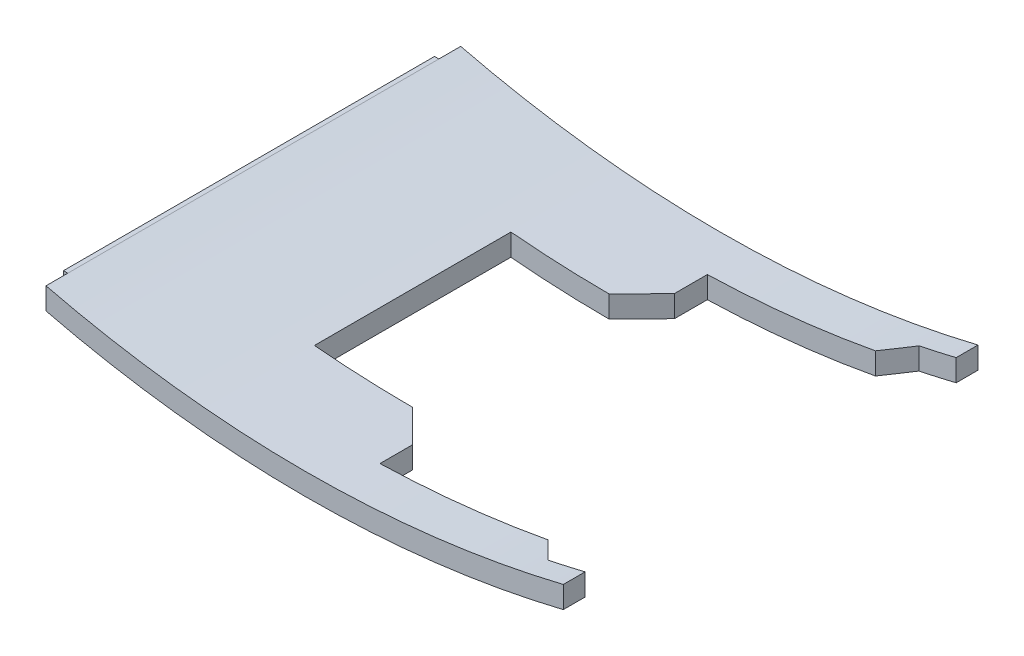
from build123d import *

# Parameters (mm, degrees)
BOSS_EXTRUDE1_DEPTH = 48.26
SKETCH4_W           = 41.656
SKETCH4_H           = 22.86
CUT_EXTRUDE1_DEPTH  = 25.4
CUT_EXTRUDE2_DEPTH  = 25.4
SKETCH6_W           = 43.18
SKETCH6_H           = 2.54
BOSS_EXTRUDE2_DEPTH = 0.508
CHAMFER2_SIZE       = 3.048
CHAMFER3_SIZE       = 3.81


with BuildPart() as part:
    # Sketch1 → Boss-Extrude1 (new body)
    with BuildSketch(Plane.XY):
        with BuildLine():
            Line((0, 0), (0, 2.54))
            ThreePointArc((0, 2.54), (30.099, -1.078274453), (60.198, 2.54))
            Line((60.198, 2.54), (60.198, 0))
            ThreePointArc((60.198, 0), (30.099, -3.618274453), (0, 0))
        make_face()
    extrude(amount=BOSS_EXTRUDE1_DEPTH)

    # Sketch4 → Cut-Extrude1 (cut)
    with BuildSketch(Plane(origin=(0, 3.81, 0), x_dir=(1, 0, 0), z_dir=(0, 1, 0))):
        with Locations((39.37, -24.13)):
            Rectangle(SKETCH4_W, SKETCH4_H)
    extrude(amount=-CUT_EXTRUDE1_DEPTH, mode=Mode.SUBTRACT)

    # Sketch5 → Cut-Extrude2 (cut)
    with BuildSketch(Plane(origin=(0, 3.81, 0), x_dir=(1, 0, 0), z_dir=(0, 1, 0))):
        Polygon((33.782, -12.7), (33.782, -5.08), (56.388, -5.08), (56.388, -2.54), (60.198, -2.54), (60.198, -3.81), (60.198, -12.7), align=None)
        Polygon((33.782, -35.56), (60.198, -35.56), (60.198, -45.72), (56.388, -45.72), (56.388, -43.18), (33.782, -43.18), align=None)
    extrude(amount=-CUT_EXTRUDE2_DEPTH, mode=Mode.SUBTRACT)

    # Sketch6 → Boss-Extrude2 (add)
    with BuildSketch(Plane.ZY):
        with Locations((24.13, 1.27)):
            Rectangle(SKETCH6_W, SKETCH6_H)
    extrude(amount=BOSS_EXTRUDE2_DEPTH)

    # Chamfer2
    # the kernel refuses this chamfer: 3.048 mm, written as the material it takes off along each edge
    with BuildSketch(Plane(origin=(56.388, 9.510915582, 43.18), x_dir=(0.02749587661058498, 0, 0.9996219169112968), z_dir=(0, -1, 0))) as chamfer2_piece_1_section:
        Polygon((CHAMFER2_SIZE * 0.999621916911, CHAMFER2_SIZE * 0.0274958766106), (-CHAMFER2_SIZE * 0.0274958766106, CHAMFER2_SIZE * 0.999621916911), (0, 0), align=None)
    chamfer2_piece_1 = extrude(amount=18.216979495, mode=Mode.PRIVATE)
    chamfer2_piece_1 = split(chamfer2_piece_1, bisect_by=Plane(origin=(55.345503153, 0.402425835, 45.72), z_dir=(0, 0, -1)), keep=Keep.TOP, mode=Mode.PRIVATE)
    add(chamfer2_piece_1, mode=Mode.SUBTRACT)
    with BuildSketch(Plane(origin=(56.388, 9.510915582, 5.08), x_dir=(-0.9996219169112968, 0, 0.027495876610586396), z_dir=(0, -1, 0))) as chamfer2_piece_2_section:
        Polygon((CHAMFER2_SIZE * 0.999621916911, CHAMFER2_SIZE * 0.0274958766106), (-CHAMFER2_SIZE * 0.0274958766106, CHAMFER2_SIZE * 0.999621916911), (0, 0), align=None)
    chamfer2_piece_2 = extrude(amount=18.216979495, mode=Mode.PRIVATE)
    chamfer2_piece_2 = split(chamfer2_piece_2, bisect_by=Plane(origin=(55.345503153, 0.402425835, 2.54), z_dir=(0, 0, 1)), keep=Keep.TOP, mode=Mode.PRIVATE)
    add(chamfer2_piece_2, mode=Mode.SUBTRACT)

    # Chamfer3
    chamfer3_edges = [part.edges().sort_by_distance(p)[0] for p in [
        (33.782, -2.29485972, 12.7),
        (33.782, -2.29485972, 35.56),
    ]]
    chamfer(chamfer3_edges, length=CHAMFER3_SIZE)


solid = part.part
